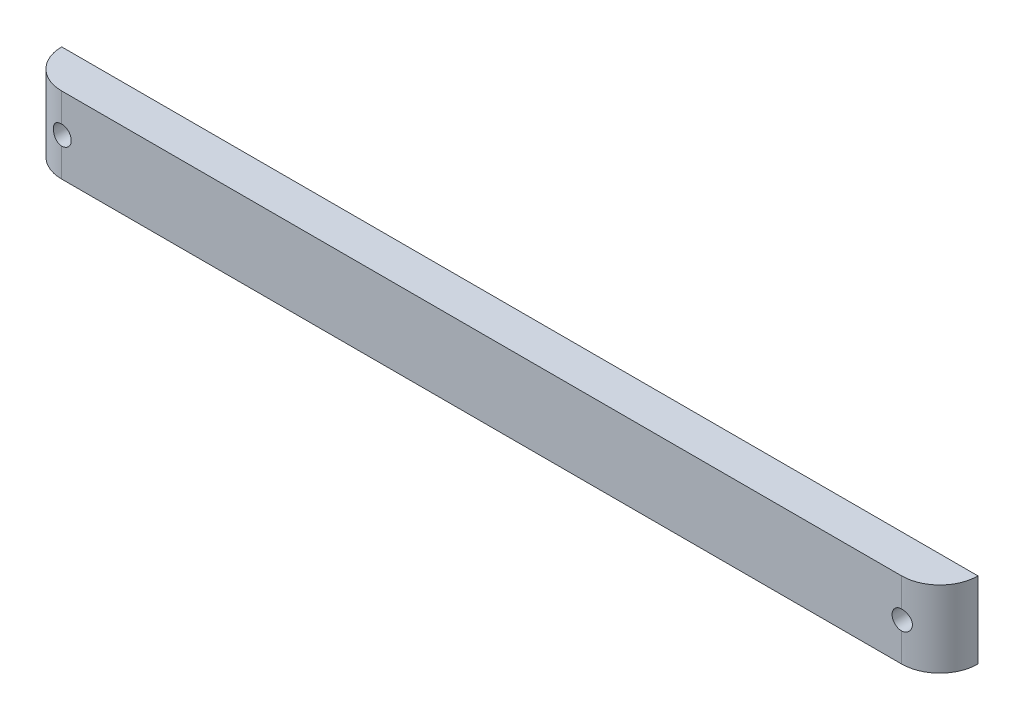
from build123d import *

# Parameters (mm, degrees)
SKETCH1_W           = 240
SKETCH1_H           = 20
SKETCH1_R           = 2.5
BOSS_EXTRUDE1_DEPTH = 10
FILLET1_START       = -1
FILLET1_DEPTH       = 22


with BuildPart() as part:
    # Sketch1 → Boss-Extrude1 (new body)
    with BuildSketch(Plane.XY):
        with Locations((120, 10)):
            Rectangle(SKETCH1_W, SKETCH1_H)
        with Locations((230, 10)):
            Circle(SKETCH1_R, mode=Mode.SUBTRACT)
        with Locations((10, 10)):
            Circle(SKETCH1_R, mode=Mode.SUBTRACT)
    extrude(amount=BOSS_EXTRUDE1_DEPTH)

    # Fillet1: read off the stored shape, not the designer's step
    # Fillet1 outline → Fillet1 (cut)
    with BuildSketch(Plane(origin=(0, 0, 0), x_dir=(1, 0, 0), z_dir=(0, 1, 0)).offset(FILLET1_START)):
        with BuildLine():
            Line((0, -10), (10, -10))
            ThreePointArc((10, -10), (2.928932188, -7.071067812), (0, 0))
            Line((0, 0), (0, -10))
        make_face()
        with BuildLine():
            ThreePointArc((240, 0), (237.071067812, -7.071067812), (230, -10))
            Line((230, -10), (240, -10))
            Line((240, -10), (240, 0))
        make_face()
    extrude(amount=FILLET1_DEPTH, mode=Mode.SUBTRACT)


solid = part.part
